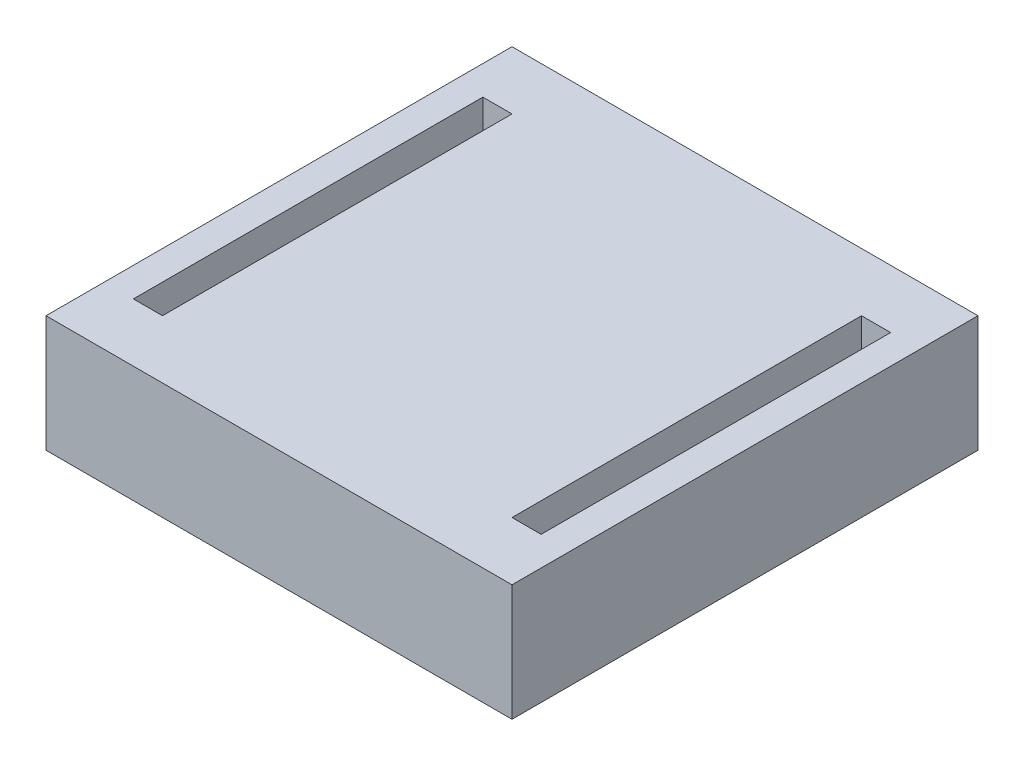
from build123d import *

# Parameters (mm, degrees)
SKETCH1_W           = 20
SKETCH1_H           = 20
SKETCH1_W_2         = 1.25
SKETCH1_H_2         = 15
BOSS_EXTRUDE5_DEPTH = 5


with BuildPart() as part:
    # Sketch1 → Boss-Extrude5 (new body)
    with BuildSketch(Plane(origin=(0, 0, 0), x_dir=(1, 0, 0), z_dir=(0, 1, 0))):
        with Locations((9.17581967, 10)):
            Rectangle(SKETCH1_W, SKETCH1_H)
        with Locations((1.050035137, 10)):
            Rectangle(SKETCH1_W_2, SKETCH1_H_2, mode=Mode.SUBTRACT)
        with Locations((17.30081967, 10)):
            Rectangle(SKETCH1_W_2, SKETCH1_H_2, mode=Mode.SUBTRACT)
    extrude(amount=BOSS_EXTRUDE5_DEPTH)


solid = part.part
